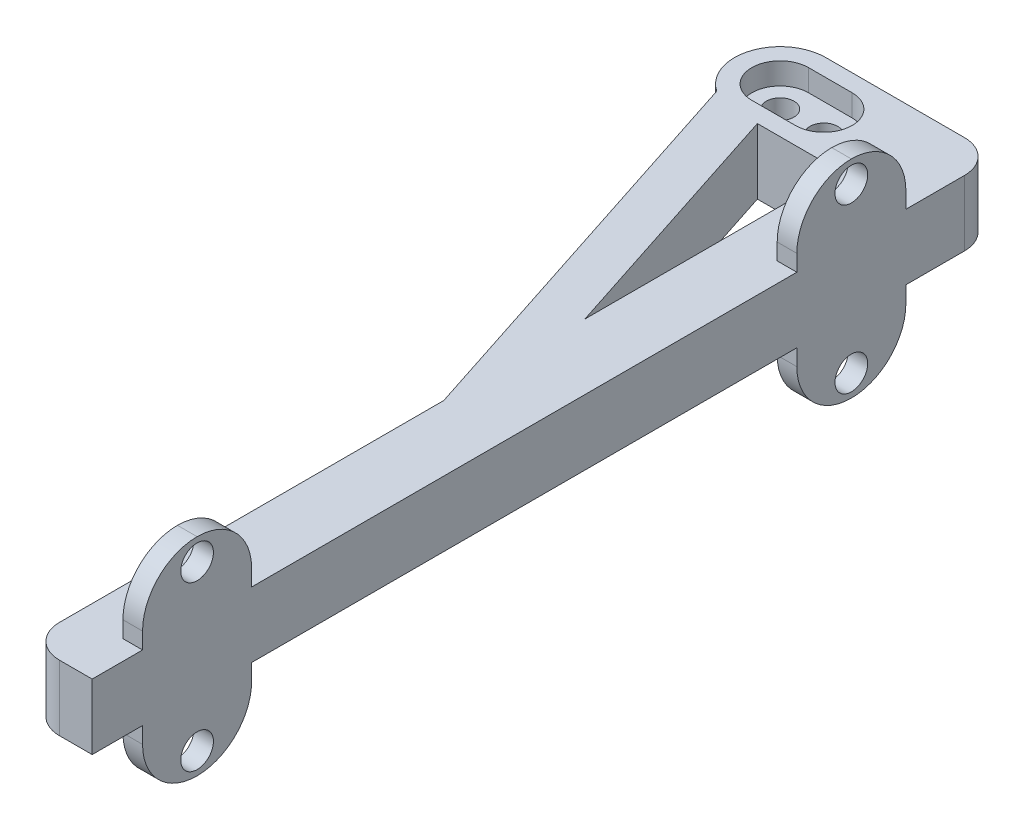
from build123d import *

# Parameters (mm, degrees)
SALIENTE_EXTRUIR1_DEPTH = 3
SALIENTE_EXTRUIR2_DEPTH = 1
CROQUIS1_7_W            = 1.8
CROQUIS1_7_H            = 10
SALIENTE_EXTRUIR4_DEPTH = 9.5
REDONDEO2_R             = 5
CROQUIS3_R              = 1.5
CORTAR_EXTRUIR2_DEPTH   = 16


with BuildPart() as part:
    # Croquis1 → Saliente-Extruir1 (new, symmetric)
    with BuildSketch(Plane(origin=(0, 0, 0), x_dir=(1, 0, 0), z_dir=(0, 1, 0))):
        with BuildLine():
            Line((-1.861867424, 4.190006044), (10.856046359, 4.190006044))
            ThreePointArc((10.856046359, 4.190006044), (12.977366702, 3.311326387), (13.856046359, 1.190006044))
            Line((13.856046359, 1.190006044), (13.856046359, -78.809993956))
            Line((13.856046359, -78.809993956), (10.856046359, -78.809993956))
            ThreePointArc((10.856046359, -78.809993956), (8.734726015, -77.9313143), (7.856046359, -75.809993956))
            Line((7.856046359, -75.809993956), (7.856046359, -40.566421369))
            Line((7.856046359, -40.566421369), (-4.195556186, -3.47994934))
            ThreePointArc((-4.195556186, -3.47994934), (-5.870430721, 1.219660174), (-1.861867424, 4.190006044))
        make_face()
        with BuildLine():
            Line((-1.861867424, 2.6), (2.138132576, 2.6))
            ThreePointArc((2.138132576, 2.6), (4.738132576, 0), (2.138132576, -2.6))
            Line((2.138132576, -2.6), (-1.861867424, -2.6))
            ThreePointArc((-1.861867424, -2.6), (-4.461867424, 0), (-1.861867424, 2.6))
        make_face(mode=Mode.SUBTRACT)
        Polygon((0.241081645, -4.190006044), (7.856046359, -4.190006044), (7.856046359, -27.623584675), align=None, mode=Mode.SUBTRACT)
    extrude(amount=SALIENTE_EXTRUIR1_DEPTH, both=True)

    # Croquis1<3> → Saliente-Extruir2 (add, symmetric)
    with BuildSketch(Plane(origin=(0, 0, 0), x_dir=(1, 0, 0), z_dir=(0, 1, 0))):
        with BuildLine():
            ThreePointArc((-1.861867424, 2.6), (-3.700345055, 1.838477631), (-4.461867424, 0))
            ThreePointArc((-4.461867424, 0), (-3.700345055, -1.838477631), (-1.861867424, -2.6))
            Line((-1.861867424, -2.6), (2.138132576, -2.6))
            ThreePointArc((2.138132576, -2.6), (4.738132576, 0), (2.138132576, 2.6))
            Line((2.138132576, 2.6), (-1.861867424, 2.6))
        make_face()
        with BuildLine():
            ThreePointArc((-0.591867424, 0), (-1.861867424, -1.27), (-3.131867424, 0))
            ThreePointArc((-3.131867424, 0), (-1.861867424, 1.27), (-0.591867424, 0))
        make_face(mode=Mode.SUBTRACT)
        with BuildLine():
            ThreePointArc((3.408132576, 0), (2.138132576, -1.27), (0.868132576, 0))
            ThreePointArc((0.868132576, 0), (2.138132576, 1.27), (3.408132576, 0))
        make_face(mode=Mode.SUBTRACT)
    extrude(amount=SALIENTE_EXTRUIR2_DEPTH, both=True)

    # Croquis1<7> → Saliente-Extruir4 (add, symmetric)
    with BuildSketch(Plane(origin=(0, 0, 0), x_dir=(1, 0, 0), z_dir=(0, 1, 0))):
        with Locations((12.956046359, -9.190006044)):
            Rectangle(CROQUIS1_7_W, CROQUIS1_7_H)
        with Locations((12.956046359, -69.190006044)):
            Rectangle(CROQUIS1_7_W, CROQUIS1_7_H)
    extrude(amount=SALIENTE_EXTRUIR4_DEPTH, both=True)

    # Redondeo2
    # the kernel refuses this fillet: 5 mm, written as the material it takes off along each edge
    with BuildSketch(Plane(origin=(-0.443953641, -9.5, 74.190006044), x_dir=(0, 1, 0), z_dir=(1, 0, 0)), Plane(origin=(26.356046359, -9.5, 64.190006044), x_dir=(0, 1, 0), z_dir=(-1, 0, 0)), Plane(origin=(-0.443953641, -9.5, 14.190006044), x_dir=(0, 1, 0), z_dir=(1, 0, 0)), Plane(origin=(26.356046359, -9.5, 4.190006044), x_dir=(0, 1, 0), z_dir=(-1, 0, 0))) as redondeo2_piece_1:
        with BuildLine():
            CenterArc((REDONDEO2_R, -REDONDEO2_R), REDONDEO2_R, 90, 90)
            Line((0, -REDONDEO2_R), (-REDONDEO2_R * 0.02, -REDONDEO2_R))
            Line((-REDONDEO2_R * 0.02, -REDONDEO2_R), (-REDONDEO2_R * 0.02, REDONDEO2_R * 0.02))
            Line((-REDONDEO2_R * 0.02, REDONDEO2_R * 0.02), (REDONDEO2_R, REDONDEO2_R * 0.02))
            Line((REDONDEO2_R, REDONDEO2_R * 0.02), (REDONDEO2_R, 0))
        make_face()
    extrude(amount=26.8, mode=Mode.SUBTRACT)
    with BuildSketch(Plane(origin=(-0.443953641, 9.5, 74.190006044), x_dir=(0, -1, 0), z_dir=(1, 0, 0)), Plane(origin=(26.356046359, 9.5, 64.190006044), x_dir=(0, -1, 0), z_dir=(-1, 0, 0)), Plane(origin=(-0.443953641, 9.5, 14.190006044), x_dir=(0, -1, 0), z_dir=(1, 0, 0)), Plane(origin=(26.356046359, 9.5, 4.190006044), x_dir=(0, -1, 0), z_dir=(-1, 0, 0))) as redondeo2_piece_2:
        with BuildLine():
            CenterArc((REDONDEO2_R, REDONDEO2_R), REDONDEO2_R, 180, 90)
            Line((0, REDONDEO2_R), (-REDONDEO2_R * 0.02, REDONDEO2_R))
            Line((-REDONDEO2_R * 0.02, REDONDEO2_R), (-REDONDEO2_R * 0.02, -REDONDEO2_R * 0.02))
            Line((-REDONDEO2_R * 0.02, -REDONDEO2_R * 0.02), (REDONDEO2_R, -REDONDEO2_R * 0.02))
            Line((REDONDEO2_R, -REDONDEO2_R * 0.02), (REDONDEO2_R, 0))
        make_face()
    extrude(amount=26.8, mode=Mode.SUBTRACT)

    # Croquis3 → Cortar-Extruir2 (cut)
    with BuildSketch(Plane(origin=(13.856046359, 0, 0), x_dir=(0, 0, -1), z_dir=(1, 0, 0))):
        with Locations((-69.190006044, 7.5)):
            Circle(CROQUIS3_R)
        with Locations((-69.190006044, -7.5)):
            Circle(CROQUIS3_R)
        with Locations((-9.190006044, 7.5)):
            Circle(CROQUIS3_R)
        with Locations((-9.190006044, -7.5)):
            Circle(CROQUIS3_R)
    extrude(amount=-CORTAR_EXTRUIR2_DEPTH, mode=Mode.SUBTRACT)


solid = part.part
